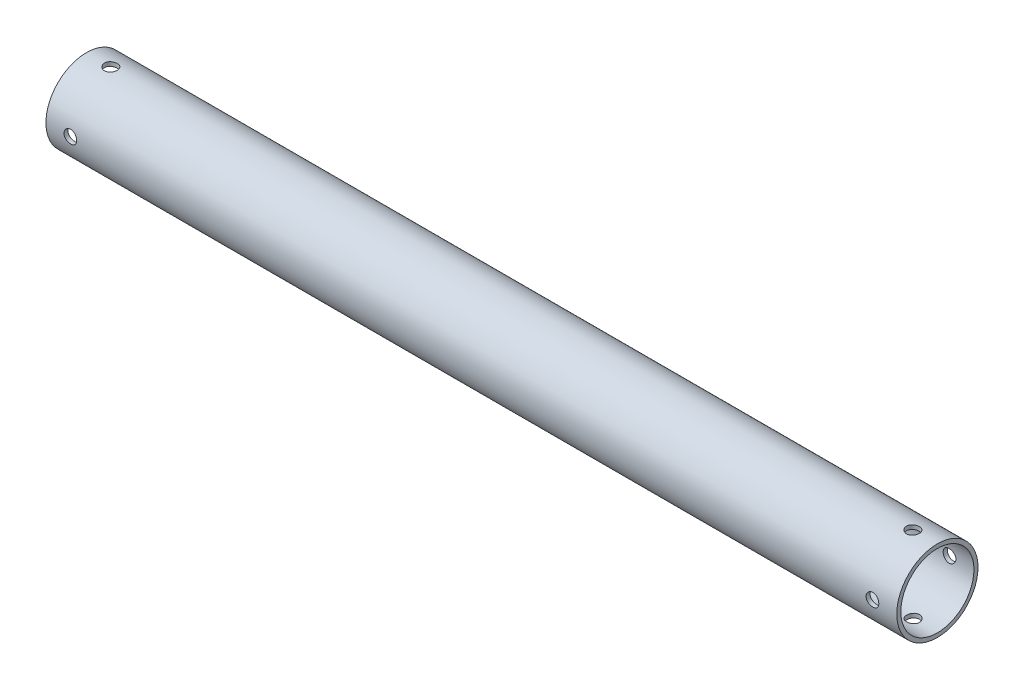
from build123d import *

# Parameters (mm, degrees)
SKETCH1_R               = 15.875
SKETCH1_R_2             = 14.2875
EXTRUDE_THIN1_DEPTH     = 166.290625
CUT_EXTRUDE1_DEPTH      = 168.799294435
CUT_EXTRUDE1_DEPTH_BACK = 168.799294435
SKETCH3_R               = 2.4892
CUT_EXTRUDE2_DEPTH      = 168.799294553
CUT_EXTRUDE2_DEPTH_BACK = 168.799294553
SKETCH4_R               = 2.4892


with BuildPart() as part:
    # Sketch1 → Extrude-Thin1 (new, symmetric)
    with BuildSketch(Plane(origin=(0, 0, 0), x_dir=(0, 0, -1), z_dir=(1, 0, 0))):
        Circle(SKETCH1_R)
        Circle(SKETCH1_R_2, mode=Mode.SUBTRACT)
    extrude(amount=EXTRUDE_THIN1_DEPTH, both=True)

    # Sketch3 → Cut-Extrude1 (cut, two sides: drawn at the far end of the back side and taken through both)
    with BuildSketch(Plane.XY.offset(-CUT_EXTRUDE1_DEPTH_BACK)):
        with Locations((-156.765625, 0)):
            Circle(SKETCH3_R)
        with Locations((156.765625, 0)):
            Circle(SKETCH3_R)
    extrude(amount=CUT_EXTRUDE1_DEPTH + CUT_EXTRUDE1_DEPTH_BACK, mode=Mode.SUBTRACT)

    # Sketch4 → Cut-Extrude2 (cut, two sides: drawn at the far end of the back side and taken through both)
    with BuildSketch(Plane(origin=(0, 0, 0), x_dir=(1, 0, 0), z_dir=(0, 1, 0)).offset(-CUT_EXTRUDE2_DEPTH_BACK)):
        with Locations((156.765625, 0)):
            Circle(SKETCH4_R)
        with Locations((-156.765625, 0)):
            Circle(SKETCH4_R)
    extrude(amount=CUT_EXTRUDE2_DEPTH + CUT_EXTRUDE2_DEPTH_BACK, mode=Mode.SUBTRACT)


solid = part.part
